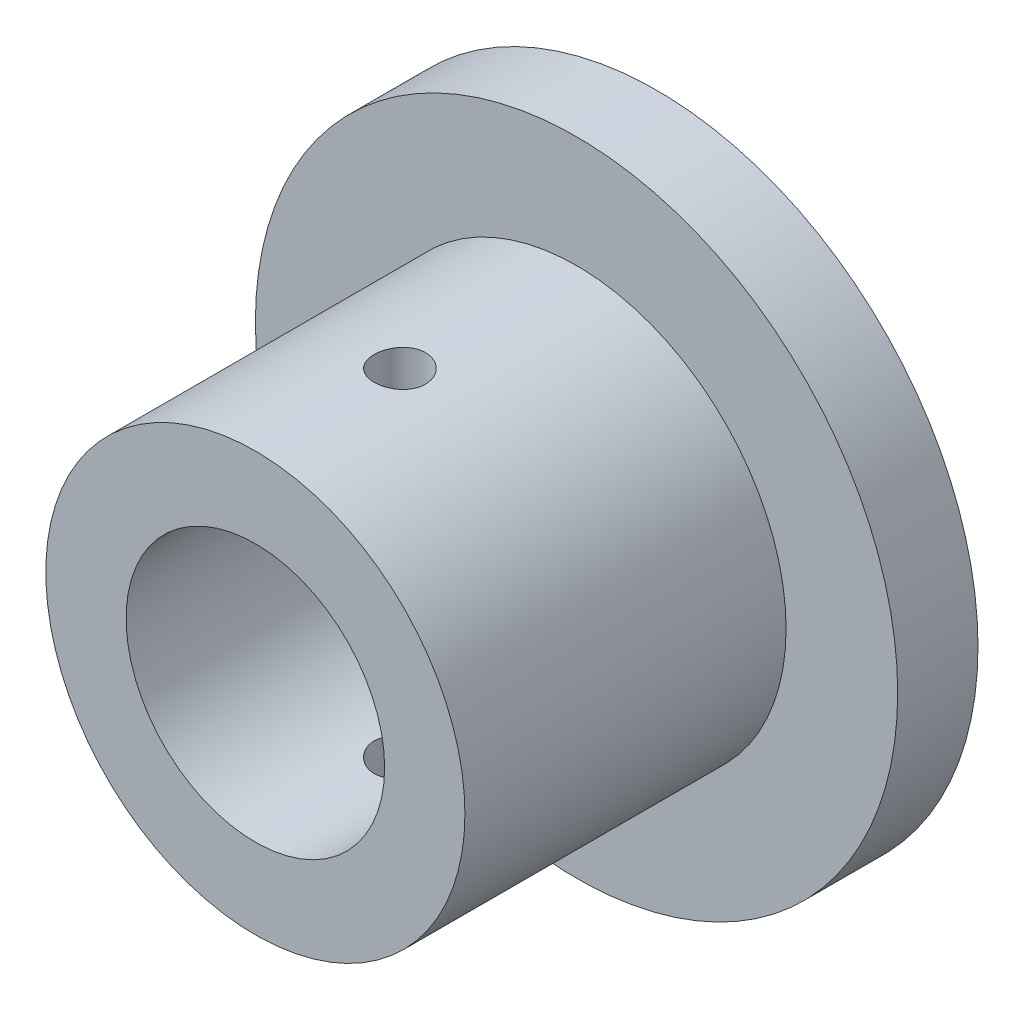
from build123d import *

# Parameters (mm, degrees)
CROQUIS1_R              = 20
SALIENTE_EXTRUIR1_DEPTH = 5
CROQUIS2_R              = 13.05
CROQUIS2_R_2            = 8.05
SALIENTE_EXTRUIR2_DEPTH = 20
CROQUIS3_R              = 1.6
CORTAR_EXTRUIR1_DEPTH   = 20


with BuildPart() as part:
    # Croquis1 → Saliente-Extruir1 (new body)
    with BuildSketch(Plane.XY):
        Circle(CROQUIS1_R)
    extrude(amount=SALIENTE_EXTRUIR1_DEPTH)

    # Croquis2 → Saliente-Extruir2 (add)
    with BuildSketch(Plane.XY.offset(5)):
        Circle(CROQUIS2_R)
        Circle(CROQUIS2_R_2, mode=Mode.SUBTRACT)
    extrude(amount=SALIENTE_EXTRUIR2_DEPTH)

    # Croquis3 → Cortar-Extruir1 (cut, symmetric)
    with BuildSketch(Plane(origin=(0, 0, 0), x_dir=(1, 0, 0), z_dir=(0, 1, 0))):
        with Locations((0, -16)):
            Circle(CROQUIS3_R)
    extrude(amount=CORTAR_EXTRUIR1_DEPTH, both=True, mode=Mode.SUBTRACT)


solid = part.part
